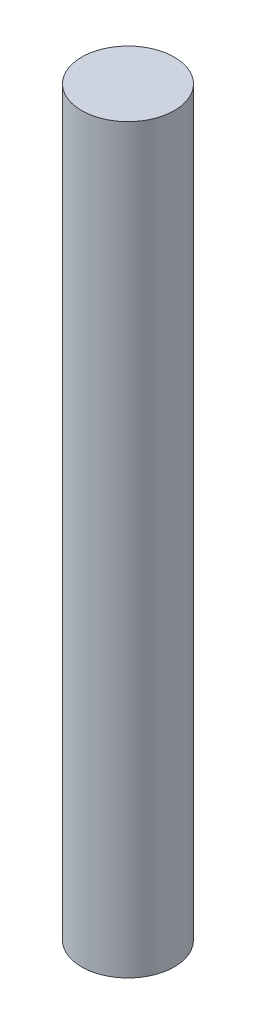
from build123d import *

# Parameters (mm, degrees)
SKETCH1_R           = 3.175
BOSS_EXTRUDE1_DEPTH = 50.8


with BuildPart() as part:
    # Sketch1 → Boss-Extrude1 (new body)
    with BuildSketch(Plane(origin=(0, 0, 0), x_dir=(1, 0, 0), z_dir=(0, 1, 0))):
        Circle(SKETCH1_R)
    extrude(amount=-BOSS_EXTRUDE1_DEPTH)


solid = part.part
